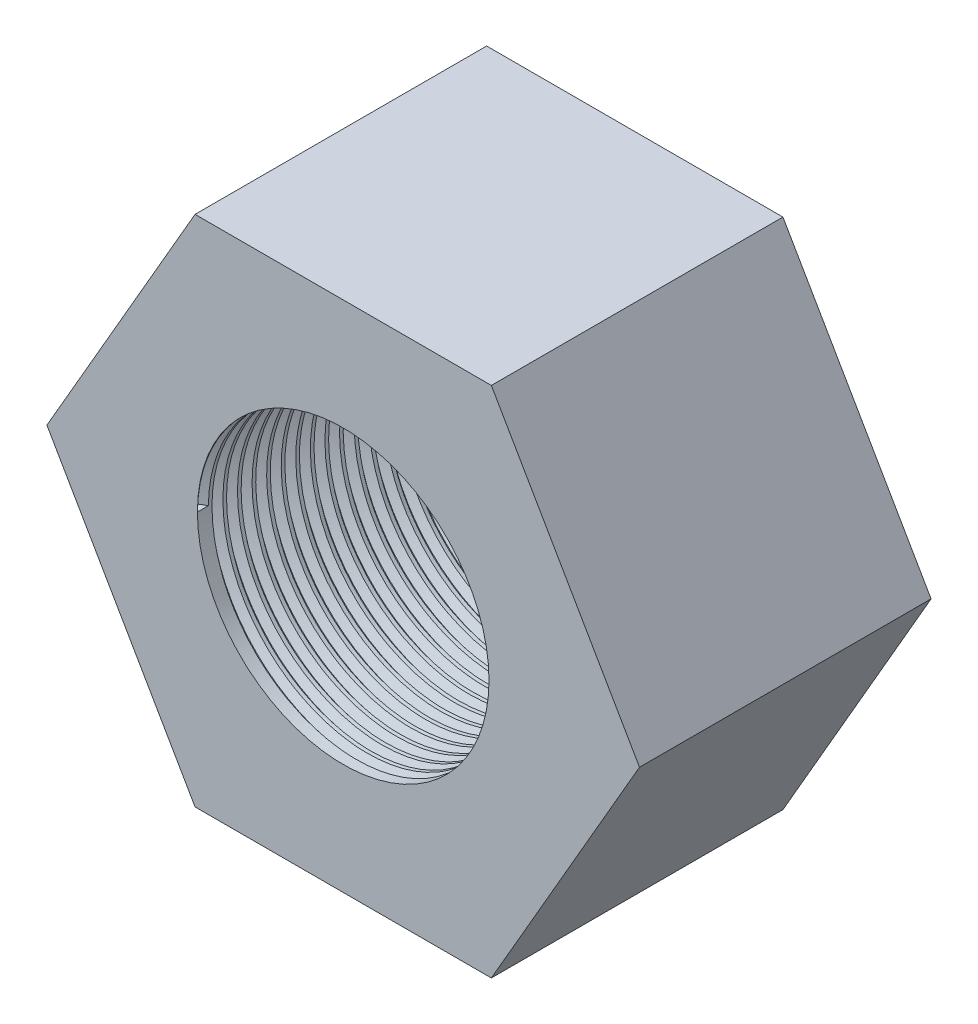
from build123d import *

# Parameters (mm, degrees)
SKETCH1_R           = 3.175
BOSS_EXTRUDE1_DEPTH = 6.35
THREAD1_PITCH       = 0.3175


with BuildPart() as part:
    # Sketch1 → Boss-Extrude1 (new body)
    with BuildSketch(Plane.XY):
        Polygon((6.452466608, 0), (3.226233304, 5.588), (-3.226233304, 5.588), (-6.452466608, 0), (-3.226233304, -5.588), (3.226233304, -5.588), align=None)
        Circle(SKETCH1_R, mode=Mode.SUBTRACT)
    extrude(amount=BOSS_EXTRUDE1_DEPTH)

    # Thread1: the profile of Thread Profile1 profile screwed along a right-hand helix of 20 turns, 6 arcs to a turn; built about Z, then put on its axis
    thread1_z = Axis((0, 0, 0), (0, 0, 1))
    thread1_corners = [(3.1747, 0, -0.000173205), (3.346851915, 0, 0.09921875), (3.346851915, 0, 0.13890625), (3.1747, 0, 0.238298204)]
    with BuildLine(mode=Mode.PRIVATE) as thread1_profile:
        Line(thread1_corners[0], thread1_corners[1])
        Line(thread1_corners[1], thread1_corners[2])
        Line(thread1_corners[2], thread1_corners[3])
        Line(thread1_corners[3], thread1_corners[0])
    thread1_cap = Face(thread1_profile.wire())
    thread1_turn_angles = [0, 30, 60, 90, 120, 150, 180, 210, 240, 270, 300, 330, 360]
    thread1_turn_weights = [1, 0.8660254037844387, 1, 0.8660254037844387, 1, 0.8660254037844387, 1, 0.8660254037844387, 1, 0.8660254037844387, 1, 0.8660254037844387, 1]
    thread1_turn_rails = [Edge.make_bspline([Vector(p[0], p[1], 0).rotate(thread1_z, thread1_turn_angles[k]) / thread1_turn_weights[k] + Vector(0, 0, p[2] + THREAD1_PITCH * thread1_turn_angles[k] / 360) for k in range(13)], [0, 0, 0, 1, 1, 2, 2, 3, 3, 4, 4, 5, 5, 6, 6, 6], 2, thread1_turn_weights) for p in thread1_corners]
    thread1_turn_sides = [Face.make_surface_from_curves(thread1_turn_rails[p[0]], thread1_turn_rails[p[1]]) for p in [(0, 1), (1, 2), (2, 3), (3, 0)]]
    thread1 = Plane(origin=(0, 0, 6.35), x_dir=(-1, 0, 0), z_dir=(0, 0, -1)) * Solid(Shell([*[p.moved(Location((0, 0, THREAD1_PITCH * i))) for i in range(20) for p in thread1_turn_sides], thread1_cap, thread1_cap.rotate(thread1_z, 7200).moved(Location((0, 0, THREAD1_PITCH * 7200 / 360)))]))
    add(thread1, mode=Mode.SUBTRACT)


solid = part.part
